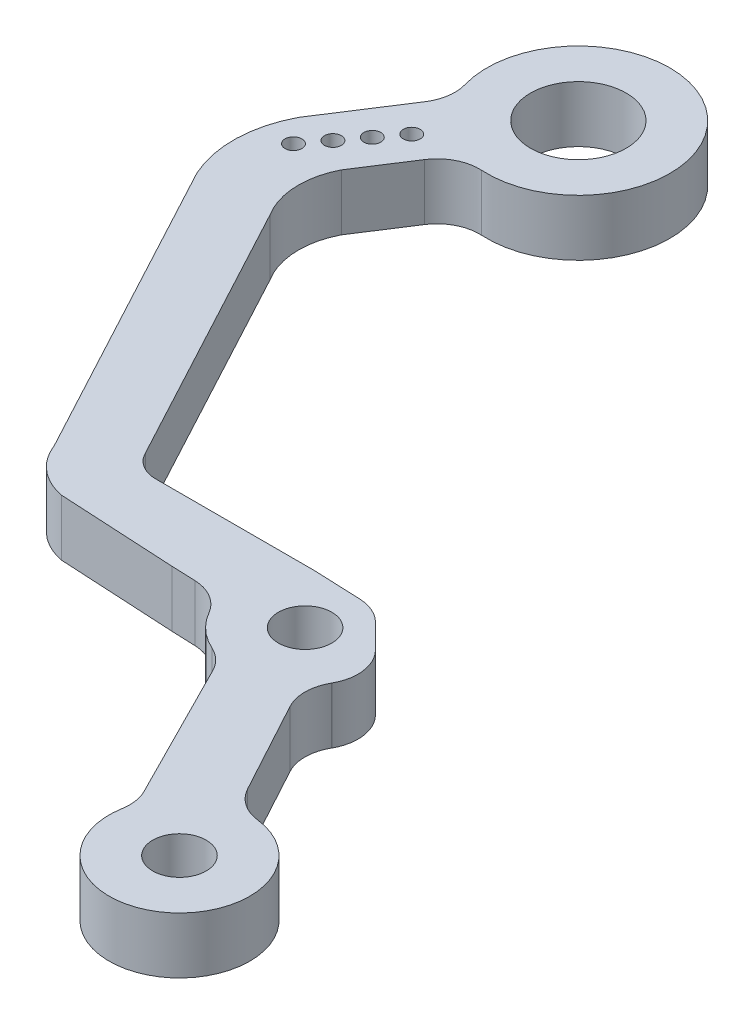
from build123d import *

# Parameters (mm, degrees)
SKETCH2_R           = 1.9
SKETCH2_R_2         = 3.4
BOSS_EXTRUDE1_DEPTH = 4
SKETCH3_R           = 0.6
CUT_EXTRUDE1_DEPTH  = 6
FILLET1_R           = 3


with BuildPart() as part:
    # Sketch2 → Boss-Extrude1 (new body)
    with BuildSketch(Plane(origin=(0, 0, 0), x_dir=(1, 0, 0), z_dir=(0, 1, 0))):
        with BuildLine():
            ThreePointArc((49.0624911, 100.728722197), (55.253975507, 111.876765002), (45.278809785, 103.932622106))
            Line((45.278809785, 103.932622106), (41.677103445, 98.359455452))
            Line((41.677103445, 98.359455452), (40.917682236, 97.184351056))
            ThreePointArc((40.917682236, 97.184351056), (40.000914232, 93.684113367), (40.729811239, 90.139986308))
            Line((40.729811239, 90.139986308), (51.995593872, 69.121735128))
            Line((51.995593872, 69.121735128), (52.448751423, 68.276291936))
            ThreePointArc((52.448751423, 68.276291936), (53.733769558, 66.46917356), (55.737555004, 65.519546097))
            Line((55.737555004, 65.519546097), (56.575581952, 65.474059755))
            Line((56.575581952, 65.474059755), (56.904280571, 65.456218685))
            Line((56.904280571, 65.456218685), (64.043852088, 65.068697747))
            Line((64.043852088, 65.068697747), (67.659658755, 64.927019071))
            ThreePointArc((67.659658755, 64.927019071), (68.973857559, 62.514332624), (71.364365032, 61.16020988))
            Line((71.364365032, 61.16020988), (77.3922419, 49.235496946))
            ThreePointArc((77.3922419, 49.235496946), (85.295038859, 43.696471142), (81.278467798, 52.471558808))
            Line((81.278467798, 52.471558808), (75.926202221, 62.342787356))
            ThreePointArc((75.926202221, 62.342787356), (77.117833046, 64.012589982), (77.538655529, 66.020358214))
            Line((77.538655529, 66.020358214), (73.882441794, 69.676571949))
            Line((73.882441794, 69.676571949), (69.341583584, 69.864669723))
            Line((69.341583584, 69.864669723), (65.404712603, 69.864669723))
            Line((65.404712603, 69.864669723), (58.04793187, 69.864669723))
            ThreePointArc((58.04793187, 69.864669723), (56.992330015, 70.157110244), (56.212176606, 70.925990854))
            ThreePointArc((56.212176606, 70.925990854), (56.161986001, 71.014595828), (56.115987655, 71.105447853))
            Line((56.115987655, 71.105447853), (45.913475043, 90.139986308))
            ThreePointArc((45.913475043, 90.139986308), (45.708651409, 90.489699119), (45.530826332, 90.853883157))
            ThreePointArc((45.530826332, 90.853883157), (45.074746145, 93.175228741), (45.661998303, 95.466907026))
            Line((45.661998303, 95.466907026), (49.0624911, 100.728722197))
        make_face()
        with Locations((82.095552315, 47.538773298)):
            Circle(SKETCH2_R, mode=Mode.SUBTRACT)
        with Locations((72.538655529, 66.020358214)):
            Circle(SKETCH2_R, mode=Mode.SUBTRACT)
        with Locations((51.053576092, 106.916256485)):
            Circle(SKETCH2_R_2, mode=Mode.SUBTRACT)
    extrude(amount=BOSS_EXTRUDE1_DEPTH)

    # Sketch3 → Cut-Extrude1 (cut)
    with BuildSketch(Plane(origin=(0, 4, 0), x_dir=(1, 0, 0), z_dir=(0, 1, 0))):
        with Locations((42.353398584, 95.378951282)):
            Circle(SKETCH3_R)
        with Locations((43.557575402, 96.975810134)):
            Circle(SKETCH3_R)
        with Locations((44.761752219, 98.572668985)):
            Circle(SKETCH3_R)
        with Locations((45.965929037, 100.169527837)):
            Circle(SKETCH3_R)
    extrude(amount=-CUT_EXTRUDE1_DEPTH, mode=Mode.SUBTRACT)

    # Fillet1
    fillet1_edges = [part.edges().sort_by_distance(p)[0] for p in [
        (77.538655529, 2, -66.020358214),
        (73.882441794, 2, -69.676571949),
        (75.926202221, 2, -62.342787356),
        (77.3922419, 2, -49.235496946),
        (81.278467798, 2, -52.471558808),
        (71.364365032, 2, -61.16020988),
        (67.659658755, 2, -64.927019071),
        (45.278809785, 2, -103.932622106),
        (49.0624911, 2, -100.728722197),
    ]]
    fillet(fillet1_edges, radius=FILLET1_R)


solid = part.part
